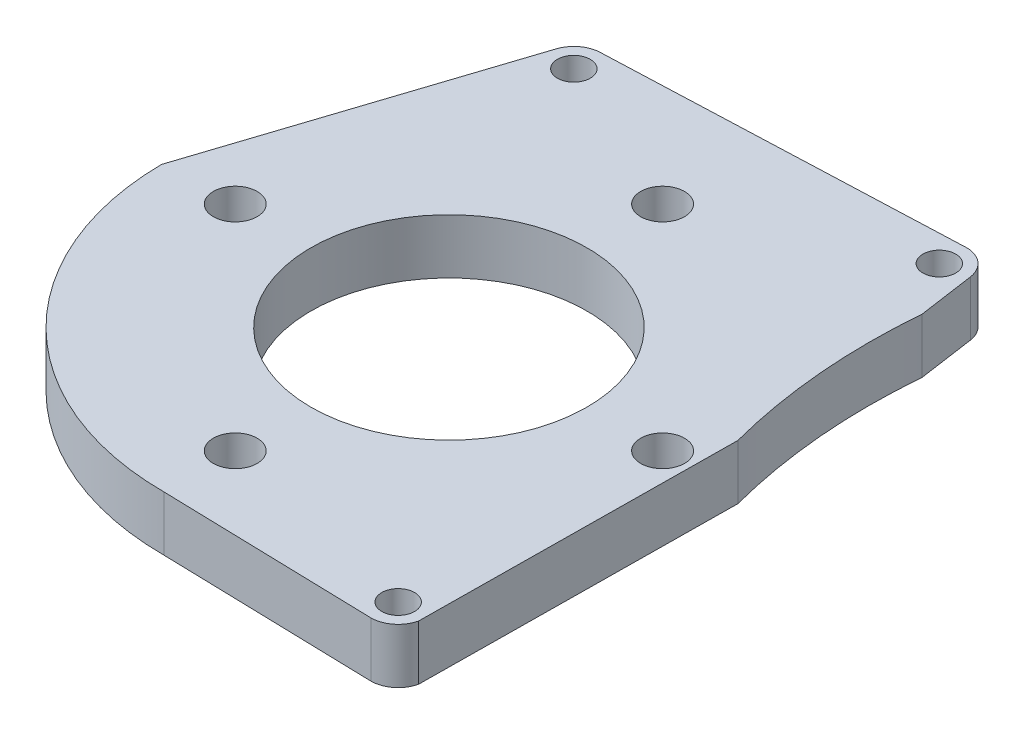
from build123d import *

# Parameters (mm, degrees)
SKETCH1_R           = 2
SKETCH1_R_2         = 1.5
SKETCH1_R_3         = 12.6
BOSS_EXTRUDE1_DEPTH = 5


with BuildPart() as part:
    # Sketch1 → Boss-Extrude1 (new body)
    with BuildSketch(Plane(origin=(0, 0, 0), x_dir=(1, 0, 0), z_dir=(0, 1, 0))):
        with BuildLine():
            Line((21.815840144, -24.591003109), (22.114752078, 4.257329215))
            ThreePointArc((22.114752078, 4.257329215), (20.537538688, 13.377382159), (20.54088968, 22.632810651))
            Line((20.54088968, 22.632810651), (19.800554822, 27.781243006))
            ThreePointArc((19.800554822, 27.781243006), (18.973100892, 29.306121933), (17.352424019, 29.925268296))
            Line((17.352424019, 29.925268296), (-14.844339104, 28.640593159))
            ThreePointArc((-14.844339104, 28.640593159), (-16.252346045, 28.136798133), (-17.120894888, 26.91945846))
            Line((-17.120894888, 26.91945846), (-25.998931524, -0.235710903))
            ThreePointArc((-25.998931524, -0.235710903), (-18.294297898, -18.474811621), (0.019571846, -25.999992634))
            Line((0.019571846, -25.999992634), (19.401077576, -26.513049605))
            ThreePointArc((19.401077576, -26.513049605), (20.940459329, -25.969135051), (21.815840144, -24.591003109))
        make_face()
        with Locations((-19.5, 0)):
            Circle(SKETCH1_R, mode=Mode.SUBTRACT)
        with Locations((0, -19.5)):
            Circle(SKETCH1_R, mode=Mode.SUBTRACT)
        with Locations((19.383548883, -24.013111057)):
            Circle(SKETCH1_R_2, mode=Mode.SUBTRACT)
        Circle(SKETCH1_R_3, mode=Mode.SUBTRACT)
        with Locations((19.5, 0)):
            Circle(SKETCH1_R, mode=Mode.SUBTRACT)
        with Locations((-14.744666529, 26.142580874)):
            Circle(SKETCH1_R_2, mode=Mode.SUBTRACT)
        with Locations((0, 19.5)):
            Circle(SKETCH1_R, mode=Mode.SUBTRACT)
        with Locations((17.326008127, 27.42540786)):
            Circle(SKETCH1_R_2, mode=Mode.SUBTRACT)
    extrude(amount=BOSS_EXTRUDE1_DEPTH)


solid = part.part
